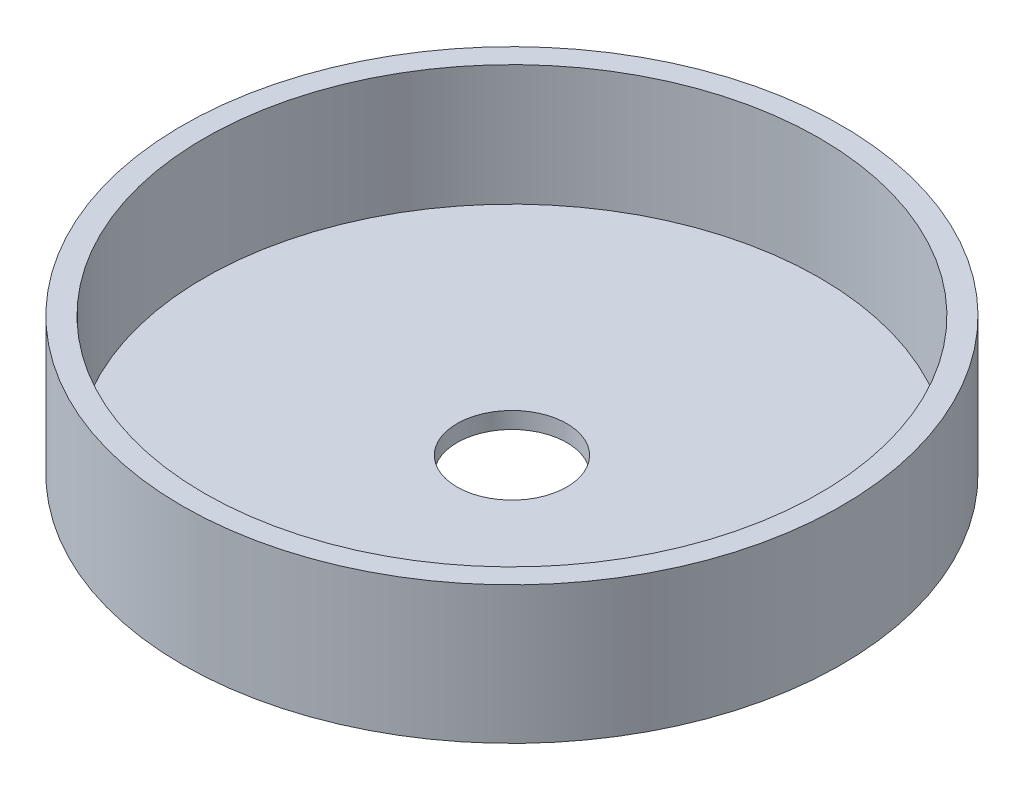
from build123d import *

# Parameters (mm, degrees)
PUCK_BASE_SKETCH_R   = 60
PUCK_BASE_SKETCH_R_2 = 10
PUCK_BASE_DEPTH      = 3
PUCK_WALL_SKETCH_R   = 60
PUCK_WALL_SKETCH_R_2 = 56
PUCK_WALL_DEPTH      = 25


with BuildPart() as part:
    # Puck Base Sketch → Puck Base (new body)
    with BuildSketch(Plane(origin=(0, 0, 0), x_dir=(1, 0, 0), z_dir=(0, 1, 0))):
        Circle(PUCK_BASE_SKETCH_R)
        Circle(PUCK_BASE_SKETCH_R_2, mode=Mode.SUBTRACT)
    extrude(amount=PUCK_BASE_DEPTH)

    # Puck Wall Sketch → Puck Wall (add)
    with BuildSketch(Plane(origin=(0, 0, 0), x_dir=(1, 0, 0), z_dir=(0, 1, 0))):
        Circle(PUCK_WALL_SKETCH_R)
        Circle(PUCK_WALL_SKETCH_R_2, mode=Mode.SUBTRACT)
    extrude(amount=PUCK_WALL_DEPTH)


solid = part.part
